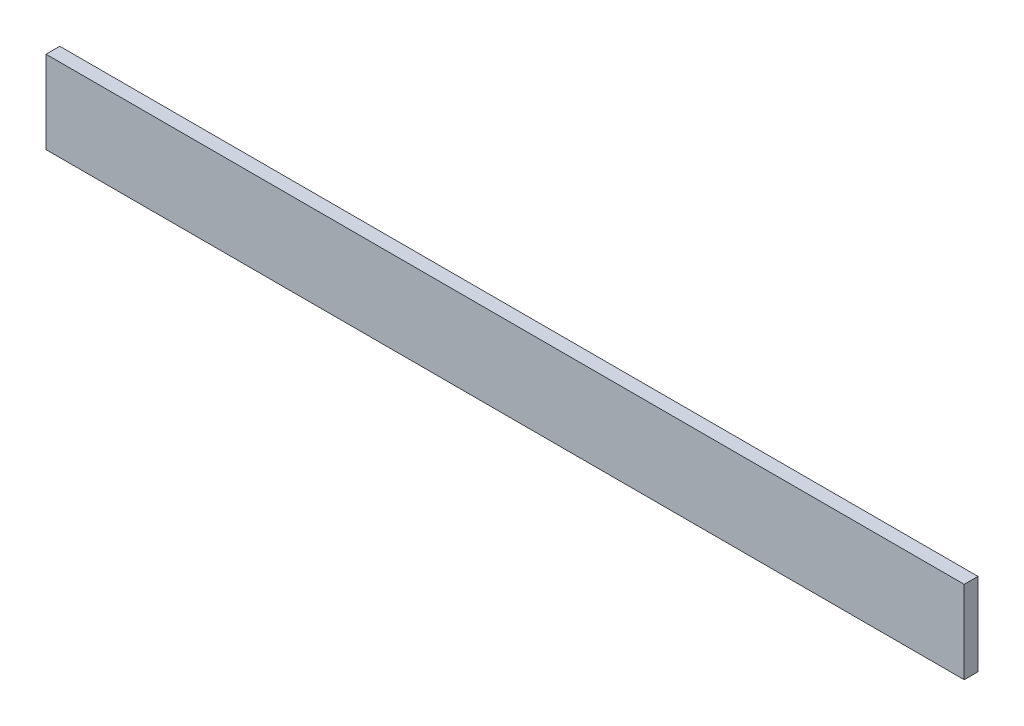
from build123d import *

# Parameters (mm, degrees)
SKETCH1_W           = 1.5
SKETCH1_H           = 9
BOSS_EXTRUDE1_DEPTH = 100


with BuildPart() as part:
    # Sketch1 → Boss-Extrude1 (new body)
    with BuildSketch(Plane(origin=(0, 0, 0), x_dir=(0, 0, -1), z_dir=(1, 0, 0))):
        Rectangle(SKETCH1_W, SKETCH1_H)
    extrude(amount=BOSS_EXTRUDE1_DEPTH)


solid = part.part
